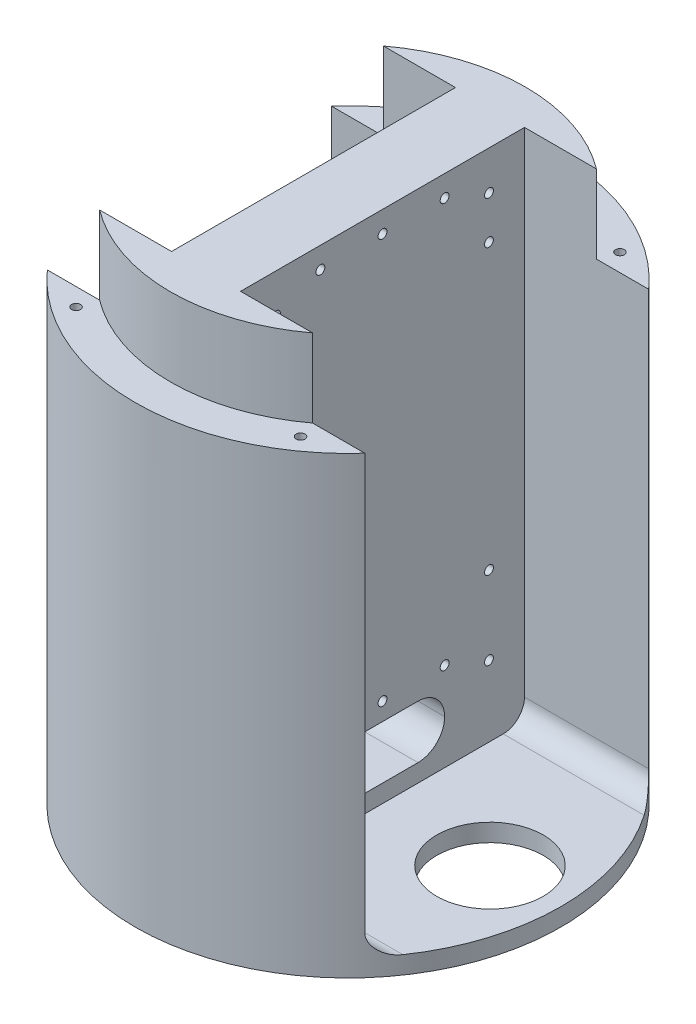
from build123d import *

# Parameters (mm, degrees)
SKETCH_1_R                         = 60
EXTRUDE_1_DEPTH                    = 150
CUT_EXTRUDE_START                  = -145
CUT_EXTRUDE_1_DEPTH                = 145
M3X0_5_6MM_D                       = 2.5
CUT_EXTRUDE_START_2                = -22
CUT_EXTRUDE_2_DEPTH                = 22
M3X0_5_SPACER_HUB_BOARD_AT_2_COUNT = 2
M3X0_5_SPACER_HUB_BOARD_AT_2_PITCH = 63.245553203
CUT_EXTRUDE_5070_DEPTH             = 169.002976164
SKETCH_14_R                        = 15
CUT_EXTRUDE_5330_DEPTH             = 173.336879396
M3X0_5_6MM_OBC_D                   = 2.5
FILLET_1_R                         = 1
M5X0_8_20MM_BASW_PLATE_D           = 4.2
M5X0_8_20MM_BASW_PLATE_DEPTH       = 14
M5X0_8_20MM_BASW_PLATE_TIP         = 1.2618073
FILLET_2_R                         = 6
FILLET_3_R                         = 6
SKETCH_19_W                        = 35
SKETCH_19_H                        = 15
CUT_EXTRUDE_3_DEPTH                = 48
FILLET_4_R                         = 7.5
M3X0_5_2_D                         = 2.5
M3X0_5_3_D                         = 2.5


with BuildPart() as part:
    # ｽｹｯﾁ1 → ﾎﾞｽ - 押し出し1 (new body)
    with BuildSketch(Plane(origin=(0, 0, 0), x_dir=(1, 0, 0), z_dir=(0, 1, 0))):
        with Locations(Location((0, 0, 0), (0, 0, 270))):
            Circle(SKETCH_1_R)
    extrude(amount=EXTRUDE_1_DEPTH)

    # ｽｹｯﾁ2 → ｶｯﾄ - 押し出し1 (cut)
    with BuildSketch(Plane(origin=(0, 150, 0), x_dir=(1, 0, 0), z_dir=(0, 1, 0)).offset(CUT_EXTRUDE_START)):
        with BuildLine():
            Line((-44.72135955, 40), (-9.72135955, 40))
            Line((-9.72135955, 40), (-9.72135955, -40))
            Line((-9.72135955, -40), (-44.72135955, -40))
            ThreePointArc((-44.72135955, -40), (-60, 0), (-44.72135955, 40))
        make_face()
    cut_extrude_1 = extrude(amount=CUT_EXTRUDE_1_DEPTH, mode=Mode.SUBTRACT)

    # ﾐﾗｰ1: ｶｯﾄ - 押し出し1 across plane
    add(cut_extrude_1.mirror(Plane(origin=(0, 0, 0), x_dir=(0, 0, 1), z_dir=(1, 0, 0))), mode=Mode.SUBTRACT)

    # ｽｹｯﾁ4 → M6x1.0(20mm) Base_Plateへの固定用ねじ穴 (revolve, cut)
    with BuildSketch(Plane(origin=(0, 0, 30), x_dir=(0, 0, -1), z_dir=(1, 0, 0))):
        Polygon((0, 0), (0, 18.502151548), (2.5, 17), (2.5, 0), align=None)
    m6x1_0_20mm_base_plate = revolve(axis=Axis((0, -6.35, 30), (0, 1, 0)), mode=Mode.SUBTRACT)

    # ﾐﾗｰ2: M6x1.0(20mm) Base_Plateへの固定用ねじ穴 across plane
    add(m6x1_0_20mm_base_plate.mirror(Plane.XY), mode=Mode.SUBTRACT)

    # M3x0.5(6mm) 送信機固定用ねじ穴 (through all)
    with Locations(Plane(origin=(9.72135955, 144, 17.5), x_dir=(0, 0, 1), z_dir=(1, 0, 0))):
        with Locations((0, 0), (-17.5, 0), (-35, 0), (-17.5, 114), (0, 114), (-35, 114)):
            Hole(M3X0_5_6MM_D / 2)

    # ｽｹｯﾁ10 → ｶｯﾄ - 押し出し2 (cut)
    with BuildSketch(Plane(origin=(0, 150, 0), x_dir=(1, 0, 0), z_dir=(0, 1, 0)).offset(CUT_EXTRUDE_START_2)):
        with BuildLine():
            Line((-30, 40), (-44.72135955, 40))
            ThreePointArc((-44.72135955, 40), (0, 60), (44.72135955, 40))
            Line((44.72135955, 40), (30, 40))
            ThreePointArc((30, 40), (0, 50), (-30, 40))
        make_face()
    cut_extrude_2 = extrude(amount=CUT_EXTRUDE_2_DEPTH, mode=Mode.SUBTRACT)

    # ﾐﾗｰ3: ｶｯﾄ - 押し出し2 across plane
    add(cut_extrude_2.mirror(Plane.XY), mode=Mode.SUBTRACT)

    # ｽｹｯﾁ12 → M3x0.5(Spacer) Hub_Board固定用ねじ穴 (revolve, cut)
    with BuildSketch(Plane(origin=(-31.622776602, 128, -45), x_dir=(0, 0, 1), z_dir=(1, 0, 0))):
        Polygon((0, 0), (0, 9.251075774), (1.25, 8.5), (1.25, 0), align=None)
    m3x0_5_spacer_hub_board = revolve(axis=Axis((-31.622776602, 134.35, -45), (0, -1, 0)), mode=Mode.SUBTRACT)

    # M3x0.5(Spacer) Hub_Board固定用ねじ穴 at 2: M3x0.5(Spacer) Hub_Board固定用ねじ穴 ×2
    with Locations(*[(i * M3X0_5_SPACER_HUB_BOARD_AT_2_PITCH, 0, 0) for i in range(1, M3X0_5_SPACER_HUB_BOARD_AT_2_COUNT)]):
        add(m3x0_5_spacer_hub_board, mode=Mode.SUBTRACT)

    # ﾐﾗｰ4: M3x0.5(Spacer) Hub_Board固定用ねじ穴 across plane
    add(m3x0_5_spacer_hub_board.mirror(Plane.XY), mode=Mode.SUBTRACT)

    # ﾐﾗｰ4 copy 1 sketch → ﾐﾗｰ4 copy 1 (revolve, cut)
    with BuildSketch(Plane(origin=(31.622776602, 128, 45), x_dir=(0, 0, -1), z_dir=(1, 0, 0))):
        Polygon((0, 0), (0, -9.251075774), (1.25, -8.5), (1.25, 0), align=None)
    revolve(axis=Axis((31.622776602, 134.35, 45), (0, 1, 0)), mode=Mode.SUBTRACT)

    # ｽｹｯﾁ13 → Cut-Extrude 5070 (cut, through all)
    with BuildSketch(Plane(origin=(0, 5, 0), x_dir=(1, 0, 0), z_dir=(0, 1, 0))):
        with BuildLine():
            Line((-25, 20), (-56.568542495, 20))
            ThreePointArc((-56.568542495, 20), (-60, 0), (-56.568542495, -20))
            Line((-56.568542495, -20), (-25, -20))
            Line((-25, -20), (-25, 20))
        make_face()
    extrude(amount=-CUT_EXTRUDE_5070_DEPTH, mode=Mode.SUBTRACT)

    # ｽｹｯﾁ14 → Cut-Extrude 5330 (cut, through all)
    with BuildSketch(Plane.XZ):
        with Locations(Location((40, 0, 0), (0, 0, 270))):
            Circle(SKETCH_14_R)
    extrude(amount=-CUT_EXTRUDE_5330_DEPTH, mode=Mode.SUBTRACT)

    # M3x0.5(6mm) OBC固定用ねじ穴 (through all)
    with Locations(Plane(origin=(-9.72135955, 139, -30), x_dir=(0, 0, -1), z_dir=(-1, 0, 0))):
        with Locations((0, 0), (-60, 0), (0, 114), (-60, 114)):
            Hole(M3X0_5_6MM_OBC_D / 2)

    # ﾌｨﾚｯﾄ1
    fillet_1_edges = [part.edges().sort_by_distance(p)[0] for p in [
        (-25, 2.5, -20),
        (-25, 2.5, 20),
    ]]
    fillet(fillet_1_edges, radius=FILLET_1_R)

    # M5x0.8(20mm) Basw_Plateへの固定用ねじ穴
    with Locations(Plane(origin=(-25, 0, 46.733285782), x_dir=(0, 0, -1), z_dir=(0, -1, 0))):
        with Locations((0, 0), (0, 50), (93.466571564, 0), (93.466571564, 50)):
            Hole(M5X0_8_20MM_BASW_PLATE_D / 2, depth=M5X0_8_20MM_BASW_PLATE_DEPTH)
            with Locations((0, 0, -(M5X0_8_20MM_BASW_PLATE_DEPTH + M5X0_8_20MM_BASW_PLATE_TIP / 2))):  # 118° drill point
                Cone(0, M5X0_8_20MM_BASW_PLATE_D / 2, M5X0_8_20MM_BASW_PLATE_TIP, mode=Mode.SUBTRACT)

    # ﾌｨﾚｯﾄ2
    fillet_2_edges = [part.edges().sort_by_distance(p)[0] for p in [
        (27.22135955, 5, 40),
        (27.22135955, 5, -40),
    ]]
    fillet(fillet_2_edges, radius=FILLET_2_R)

    # ﾌｨﾚｯﾄ3
    fillet_3_edges = [part.edges().sort_by_distance(p)[0] for p in [
        (-27.22135955, 5, -40),
        (-27.22135955, 5, 40),
    ]]
    fillet(fillet_3_edges, radius=FILLET_3_R)

    # ｽｹｯﾁ19 → ｶｯﾄ - 押し出し3 (cut)
    with BuildSketch(Plane(origin=(9.72135955, 0, 0), x_dir=(0, 0, -1), z_dir=(1, 0, 0))):
        with Locations((0, 17.5)):
            Rectangle(SKETCH_19_W, SKETCH_19_H)
    extrude(amount=-CUT_EXTRUDE_3_DEPTH, mode=Mode.SUBTRACT)

    # ﾌｨﾚｯﾄ4
    fillet_4_edges = [part.edges().sort_by_distance(p)[0] for p in [
        (0, 25, 17.5),
        (0, 10, 17.5),
        (0, 10, -17.5),
        (0, 25, -17.5),
    ]]
    fillet(fillet_4_edges, radius=FILLET_4_R - 0.0001)  # a hair under: the kernel refuses the full size

    # M3x0.5 ねじ穴2 (through all)
    with Locations(Plane(origin=(-45, 5, -25), x_dir=(0, 0, 1), z_dir=(0, 1, 0))):
        with Locations((0, 0), (0, 20), (50, 20), (50, 0)):
            Hole(M3X0_5_2_D / 2)

    # M3x0.5 ねじ穴3 (through all)
    with Locations(Plane(origin=(9.72135955, 127, 30), x_dir=(0, 0, 1), z_dir=(1, 0, 0))):
        with Locations((0, 0), (0, 80), (-60, 80), (-60, 0)):
            Hole(M3X0_5_3_D / 2)


solid = part.part
